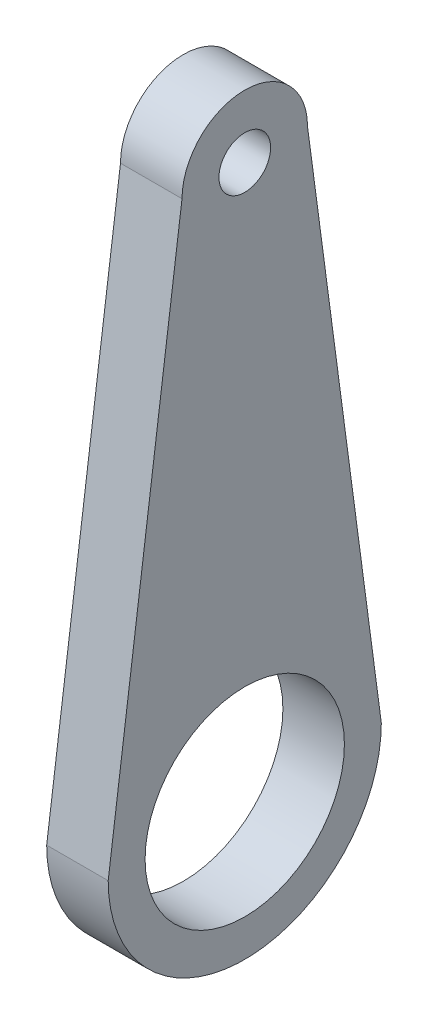
from build123d import *

# Parameters (mm, degrees)
SKETCH2_R           = 8.1
BOSS_EXTRUDE1_DEPTH = 2.5


with BuildPart() as part:
    # Sketch2 → Boss-Extrude1 (new, symmetric)
    with BuildSketch(Plane.YZ):
        with BuildLine():
            Line((45, 5.1), (0, 11.1))
            ThreePointArc((0, 11.1), (-11.1, 0), (0, -11.1))
            Line((0, -11.1), (45, -5.1))
            ThreePointArc((45, -5.1), (50.1, 0), (45, 5.1))
        make_face()
        Circle(SKETCH2_R, mode=Mode.SUBTRACT)
        with BuildLine():
            ThreePointArc((42.9, 0), (45, 2.1), (47.1, 0))
            ThreePointArc((47.1, 0), (45, -2.1), (42.9, 0))
        make_face(mode=Mode.SUBTRACT)
    extrude(amount=BOSS_EXTRUDE1_DEPTH, both=True)


solid = part.part
